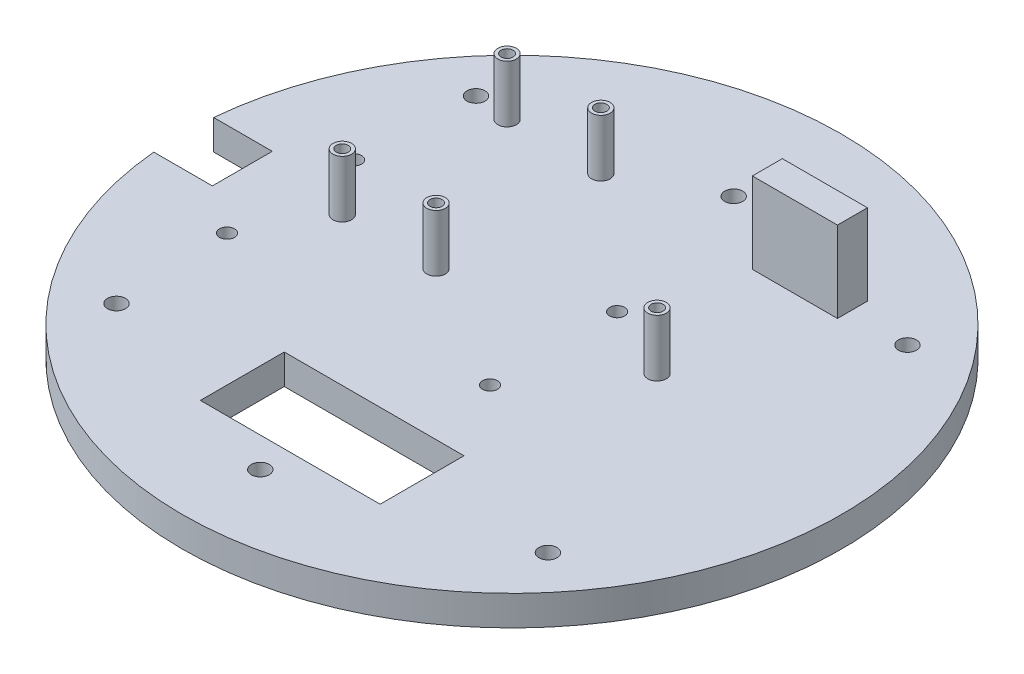
from build123d import *

# Parameters (mm, degrees)
SKETCH2_R                 = 55
SKETCH2_W                 = 30
SKETCH2_H                 = 14
BOSS_EXTRUDE1_DEPTH       = 5
SKETCH15_R                = 1.55
BOSS_EXTRUDE3_DEPTH       = 9.5
F_2_0MM_DOWEL_HOLE1_D     = 2
F_2_0MM_DOWEL_HOLE1_DEPTH = 10.15
F_2_0MM_DOWEL_HOLE1_TIP   = 0.600860619
SKETCH17_R                = 1.55
SKETCH17_W                = 14.2
SKETCH17_H                = 5
BOSS_EXTRUDE4_DEPTH       = 9.5
F_2_0MM_DOWEL_HOLE2_D     = 2
F_2_0MM_DOWEL_HOLE2_DEPTH = 10.15
F_2_0MM_DOWEL_HOLE2_TIP   = 0.600860619
SKETCH19_W                = 14.2
SKETCH19_H                = 5
BOSS_EXTRUDE5_DEPTH       = 4
SKETCH21_W                = 10
SKETCH21_H                = 10
CUT_EXTRUDE1_DEPTH        = 79.944600829
F_3_0MM_DOWEL_HOLE6_D     = 3
F_3_0MM_DOWEL_HOLE7_D     = 3
F_2_5MM_DOWEL_HOLE1_D     = 2.5


with BuildPart() as part:
    # Sketch2 → Boss-Extrude1 (new body)
    with BuildSketch(Plane(origin=(0, 0, 0), x_dir=(1, 0, 0), z_dir=(0, 1, 0))):
        Circle(SKETCH2_R)
        with Locations((0, -30)):
            Rectangle(SKETCH2_W, SKETCH2_H, mode=Mode.SUBTRACT)
    extrude(amount=BOSS_EXTRUDE1_DEPTH)

    # Sketch15 → Boss-Extrude3 (add)
    with BuildSketch(Plane(origin=(0, 5, 0), x_dir=(1, 0, 0), z_dir=(0, 1, 0))):
        with Locations((-30.02607336, 29.209873591)):
            Circle(SKETCH15_R)
        with Locations((-14.37607336, 29.209873591)):
            Circle(SKETCH15_R)
        with Locations((-14.37607336, 1.709873591)):
            Circle(SKETCH15_R)
        with Locations((-30.02607336, 1.709873591)):
            Circle(SKETCH15_R)
    extrude(amount=BOSS_EXTRUDE3_DEPTH)

    # Ø2.0mm Dowel Hole1
    with Locations(Plane(origin=(-30.02607336, 14.5, -29.209873591), x_dir=(0, 0, 1), z_dir=(0, 1, 0))):
        with Locations((0, 0), (27.5, 0), (27.5, 15.65), (0, 15.65)):
            Hole(F_2_0MM_DOWEL_HOLE1_D / 2, depth=F_2_0MM_DOWEL_HOLE1_DEPTH)
            with Locations((0, 0, -(F_2_0MM_DOWEL_HOLE1_DEPTH + F_2_0MM_DOWEL_HOLE1_TIP / 2))):  # 118° drill point
                Cone(0, F_2_0MM_DOWEL_HOLE1_D / 2, F_2_0MM_DOWEL_HOLE1_TIP, mode=Mode.SUBTRACT)

    # Sketch17 → Boss-Extrude4 (add)
    with BuildSketch(Plane(origin=(0, 5, 0), x_dir=(1, 0, 0), z_dir=(0, 1, 0))):
        with Locations((19.217395201, 5)):
            Circle(SKETCH17_R)
        with Locations((19.217395201, 30.5)):
            Rectangle(SKETCH17_W, SKETCH17_H)
    extrude(amount=BOSS_EXTRUDE4_DEPTH)

    # Ø2.0mm Dowel Hole2
    with Locations(Plane(origin=(19.217395201, 14.5, -5), x_dir=(0, 0, 1), z_dir=(0, 1, 0))):
        with Locations((0, 0)):
            Hole(F_2_0MM_DOWEL_HOLE2_D / 2, depth=F_2_0MM_DOWEL_HOLE2_DEPTH)
            with Locations((0, 0, -(F_2_0MM_DOWEL_HOLE2_DEPTH + F_2_0MM_DOWEL_HOLE2_TIP / 2))):  # 118° drill point
                Cone(0, F_2_0MM_DOWEL_HOLE2_D / 2, F_2_0MM_DOWEL_HOLE2_TIP, mode=Mode.SUBTRACT)

    # Sketch19 → Boss-Extrude5 (add)
    with BuildSketch(Plane(origin=(0, 14.5, 0), x_dir=(1, 0, 0), z_dir=(0, 1, 0))):
        with Locations((19.217395201, 30.5)):
            Rectangle(SKETCH19_W, SKETCH19_H)
    extrude(amount=BOSS_EXTRUDE5_DEPTH)

    # Sketch21 → Cut-Extrude1 (cut, through all)
    with BuildSketch(Plane(origin=(0, 5, 0), x_dir=(1, 0, 0), z_dir=(0, 1, 0))):
        with Locations((-50, 0)):
            Rectangle(SKETCH21_W, SKETCH21_H)
    extrude(amount=-CUT_EXTRUDE1_DEPTH, mode=Mode.SUBTRACT)

    # Ø3.0mm Dowel Hole6 (through all)
    with Locations(Plane(origin=(0, 0, 42), x_dir=(0, 0, -1), z_dir=(0, -1, 0))):
        with Locations((0, 0), (79, 0)):
            Hole(F_3_0MM_DOWEL_HOLE6_D / 2)

    # Ø3.0mm Dowel Hole7 (through all)
    with Locations(Plane(origin=(-36, 0, 30), x_dir=(0, 0, -1), z_dir=(0, -1, 0))):
        with Locations((0, 0), (0, 72), (60, 72), (60, 0)):
            Hole(F_3_0MM_DOWEL_HOLE7_D / 2)

    # Ø2.5mm Dowel Hole1 (through all)
    with Locations(Plane(origin=(-36.95, 0, 10.6), x_dir=(0, 0, -1), z_dir=(0, -1, 0))):
        with Locations((0, 0), (0, 43.9), (21.2, 43.9), (21.2, 0)):
            Hole(F_2_5MM_DOWEL_HOLE1_D / 2)


solid = part.part
